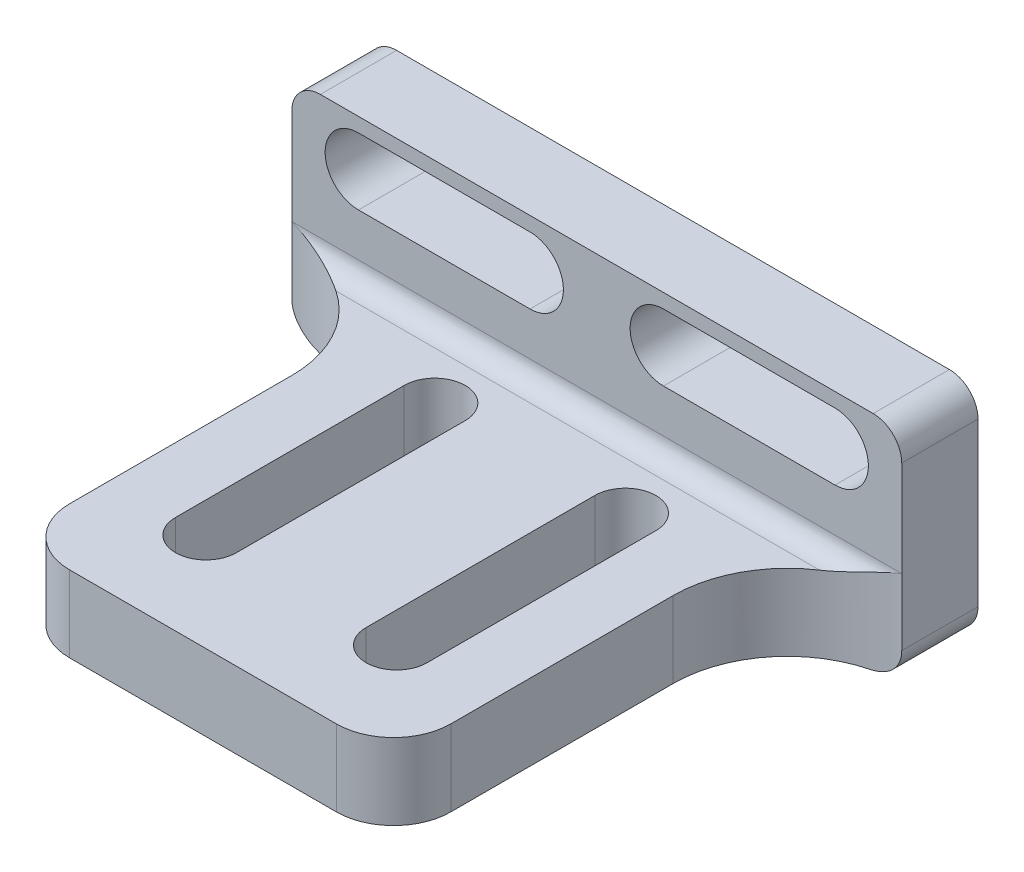
from build123d import *

# Parameters (mm, degrees)
EXTRUDE_1_DEPTH           = 3
SKETCH_7_R                = 2.25
CUT_EXTRUDE_2_DEPTH       = 143.955430949
SKETCH_8_R                = 8
CUT_EXTRUDE_3_DEPTH       = 143.955430949
CUT_EXTRUDE_4_DEPTH       = 3
CUT_EXTRUDE_5_DEPTH       = 3
CUT_EXTRUDE_8_DEPTH       = 3
SKETCH_12_R               = 1.7
CUT_EXTRUDE_9_DEPTH       = 3
SKETCH_13_R               = 1.7
CUT_EXTRUDE_11_DEPTH      = 3
CUT_EXTRUDE_12_DEPTH      = 143.955430949
FILLET_1_R                = 2
FILLET_2_R                = 2
CUT_EXTRUDE_13_DEPTH      = 143.955430949
CUT_EXTRUDE_14_DEPTH      = 143.955430949
CUT_EXTRUDE_15_DEPTH      = 143.955430949
CUT_EXTRUDE_16_DEPTH      = 143.955430949
EXTRUDE_2_DEPTH           = 4
EXTRUDE_2_2_DEPTH         = 4
EXTRUDE_4_DEPTH           = 4
EXTRUDE_5_DEPTH           = 35
SKETCH_25_W               = 6
SKETCH_25_H               = 31
CUT_EXTRUDE_17_DEPTH      = 5
FILLET_3_R                = 6
FILLET_4_R                = 6
FILLET_5_R                = 1.5
FILLET_6_R                = 1.5
CUT_EXTRUDE_18_DEPTH      = 5
CUT_EXTRUDE_19_DEPTH      = 15
CUT_EXTRUDE_19_DEPTH_BACK = 95
SKETCH_27_W               = 31
SKETCH_27_H               = 1
FILLET_8_R                = 1
FILLET_9_R                = 1
FILLET_10_R               = 3
SKETCH_28_W               = 85
SKETCH_28_H               = 10.343066278
CUT_EXTRUDE_20_DEPTH      = 5
FILLET_12_R               = 3
FILLET_13_R               = 3
SKETCH_32_W               = 45.323158308
SKETCH_32_H               = 39.541616474
CUT_EXTRUDE_22_DEPTH      = 40


# Read off the part's stored shape, not the designer's step: 切除-拉伸21
# Some blends are built 0.0001 mm under size
with BuildPart() as part:
    # 草图1 → 凸台-拉伸1 (new body)
    # profile 1 of 14: a face of its own
    with BuildSketch(Plane.XY):
        with BuildLine():
            Line((60, 106.603296002), (35.889163634, 121.664519159))
            Line((35.889163634, 121.664519159), (-35.889163634, 121.664519159))
            Line((-35.889163634, 121.664519159), (-60, 106.603296002))
            Line((-60, 106.603296002), (-60, 94.801892265))
            Line((-60, 94.801892265), (-45, 94.801892265))
            ThreePointArc((-45, 94.801892265), (-43.762563133, 94.289329132), (-43.25, 93.051892265))
            Line((-43.25, 93.051892265), (-37.75, 93.051892265))
            ThreePointArc((-37.75, 93.051892265), (-37.237436867, 94.289329132), (-36, 94.801892265))
            Line((-36, 94.801892265), (-21, 94.801892265))
            ThreePointArc((-21, 94.801892265), (-19.762563133, 94.289329132), (-19.25, 93.051892265))
            Line((-19.25, 93.051892265), (19.25, 93.051892265))
            ThreePointArc((19.25, 93.051892265), (19.762563133, 94.289329132), (21, 94.801892265))
            Line((21, 94.801892265), (36, 94.801892265))
            ThreePointArc((36, 94.801892265), (37.237436867, 94.289329132), (37.75, 93.051892265))
            Line((37.75, 93.051892265), (43.25, 93.051892265))
            ThreePointArc((43.25, 93.051892265), (43.762563133, 94.289329132), (45, 94.801892265))
            Line((45, 94.801892265), (60, 94.801892265))
            Line((60, 94.801892265), (60, 106.603296002))
        make_face()
    # profile 2 of 14: a face of its own
    with BuildSketch(Plane.XY):
        with BuildLine():
            Line((66.901694095, 102.292041372), (60, 106.603296002))
            Line((60, 106.603296002), (60, 94.801892265))
            ThreePointArc((60, 94.801892265), (61.237436867, 94.289329132), (61.75, 93.051892265))
            Line((61.75, 93.051892265), (66.901694095, 93.051892265))
            Line((66.901694095, 93.051892265), (66.901694095, 102.292041372))
        make_face()
    # profile 3 of 14: a face of its own
    with BuildSketch(Plane.XY):
        with BuildLine():
            Line((-60, 94.801892265), (-60, 106.603296002))
            Line((-60, 106.603296002), (-66.901694095, 102.292041372))
            Line((-66.901694095, 102.292041372), (-66.901694095, 93.051892265))
            Line((-66.901694095, 93.051892265), (-61.75, 93.051892265))
            ThreePointArc((-61.75, 93.051892265), (-61.237436867, 94.289329132), (-60, 94.801892265))
        make_face()
    # profile 4 of 14: a face of its own
    with BuildSketch(Plane.XY):
        with BuildLine():
            Line((66.901694095, 63.051892265), (66.901694095, 93.051892265))
            Line((66.901694095, 93.051892265), (61.75, 93.051892265))
            ThreePointArc((61.75, 93.051892265), (61.237436867, 91.814455398), (60, 91.301892265))
            Line((60, 91.301892265), (60, 64.801892265))
            ThreePointArc((60, 64.801892265), (61.237436867, 64.289329132), (61.75, 63.051892265))
            Line((61.75, 63.051892265), (66.901694095, 63.051892265))
        make_face()
    # profile 5 of 14: a face of its own
    with BuildSketch(Plane.XY):
        with BuildLine():
            Line((-61.75, 93.051892265), (-66.901694095, 93.051892265))
            Line((-66.901694095, 93.051892265), (-66.901694095, 63.051892265))
            Line((-66.901694095, 63.051892265), (-61.75, 63.051892265))
            ThreePointArc((-61.75, 63.051892265), (-61.237436867, 64.289329132), (-60, 64.801892265))
            Line((-60, 64.801892265), (-60, 91.301892265))
            ThreePointArc((-60, 91.301892265), (-61.237436867, 91.814455398), (-61.75, 93.051892265))
        make_face()
    # profile 6 of 14: a face of its own
    with BuildSketch(Plane.XY):
        with BuildLine():
            Line((66.901694095, 52.870133869), (66.901694095, 63.051892265))
            Line((66.901694095, 63.051892265), (61.75, 63.051892265))
            ThreePointArc((61.75, 63.051892265), (61.237436867, 61.814455398), (60, 61.301892265))
            Line((60, 61.301892265), (60, 31.261343001))
            Line((60, 31.261343001), (75, 31.261343001))
            Line((75, 31.261343001), (75, 40.933889795))
            ThreePointArc((75, 40.933889795), (69.117351927, 45.658052319), (66.901694095, 52.870133869))
        make_face()
    # profile 7 of 14: a face of its own
    with BuildSketch(Plane.XY):
        with BuildLine():
            Line((60, 64.801892265), (60, 91.301892265))
            Line((60, 91.301892265), (45, 91.301892265))
            ThreePointArc((45, 91.301892265), (43.762563133, 91.814455398), (43.25, 93.051892265))
            Line((43.25, 93.051892265), (37.75, 93.051892265))
            ThreePointArc((37.75, 93.051892265), (37.237436867, 91.814455398), (36, 91.301892265))
            Line((36, 91.301892265), (21, 91.301892265))
            ThreePointArc((21, 91.301892265), (19.762563133, 91.814455398), (19.25, 93.051892265))
            Line((19.25, 93.051892265), (-19.25, 93.051892265))
            ThreePointArc((-19.25, 93.051892265), (-19.762563133, 91.814455398), (-21, 91.301892265))
            Line((-21, 91.301892265), (-36, 91.301892265))
            ThreePointArc((-36, 91.301892265), (-37.237436867, 91.814455398), (-37.75, 93.051892265))
            Line((-37.75, 93.051892265), (-43.25, 93.051892265))
            ThreePointArc((-43.25, 93.051892265), (-43.762563133, 91.814455398), (-45, 91.301892265))
            Line((-45, 91.301892265), (-60, 91.301892265))
            Line((-60, 91.301892265), (-60, 64.801892265))
            Line((-60, 64.801892265), (-45, 64.801892265))
            ThreePointArc((-45, 64.801892265), (-43.762563133, 64.289329132), (-43.25, 63.051892265))
            Line((-43.25, 63.051892265), (-37.75, 63.051892265))
            ThreePointArc((-37.75, 63.051892265), (-37.237436867, 64.289329132), (-36, 64.801892265))
            Line((-36, 64.801892265), (-21, 64.801892265))
            ThreePointArc((-21, 64.801892265), (-19.762563133, 64.289329132), (-19.25, 63.051892265))
            Line((-19.25, 63.051892265), (19.25, 63.051892265))
            ThreePointArc((19.25, 63.051892265), (19.762563133, 64.289329132), (21, 64.801892265))
            Line((21, 64.801892265), (36, 64.801892265))
            ThreePointArc((36, 64.801892265), (37.237436867, 64.289329132), (37.75, 63.051892265))
            Line((37.75, 63.051892265), (43.25, 63.051892265))
            ThreePointArc((43.25, 63.051892265), (43.762563133, 64.289329132), (45, 64.801892265))
            Line((45, 64.801892265), (60, 64.801892265))
        make_face()
    # profile 8 of 14: a face of its own
    with BuildSketch(Plane.XY):
        with BuildLine():
            Line((-61.75, 63.051892265), (-66.901694095, 63.051892265))
            Line((-66.901694095, 63.051892265), (-66.901694095, 52.870133869))
            ThreePointArc((-66.901694095, 52.870133869), (-69.117351927, 45.658052319), (-75, 40.933889795))
            Line((-75, 40.933889795), (-75, 31.261343001))
            Line((-75, 31.261343001), (-60, 31.261343001))
            Line((-60, 31.261343001), (-60, 61.301892265))
            ThreePointArc((-60, 61.301892265), (-61.237436867, 61.814455398), (-61.75, 63.051892265))
        make_face()
    # profile 9 of 14: a face of its own
    with BuildSketch(Plane.XY):
        with BuildLine():
            Line((60, 31.261343001), (60, 61.301892265))
            Line((60, 61.301892265), (45, 61.301892265))
            ThreePointArc((45, 61.301892265), (43.762563133, 61.814455398), (43.25, 63.051892265))
            Line((43.25, 63.051892265), (37.75, 63.051892265))
            ThreePointArc((37.75, 63.051892265), (37.237436867, 61.814455398), (36, 61.301892265))
            Line((36, 61.301892265), (21, 61.301892265))
            ThreePointArc((21, 61.301892265), (19.762563133, 61.814455398), (19.25, 63.051892265))
            Line((19.25, 63.051892265), (-19.25, 63.051892265))
            ThreePointArc((-19.25, 63.051892265), (-19.762563133, 61.814455398), (-21, 61.301892265))
            Line((-21, 61.301892265), (-36, 61.301892265))
            ThreePointArc((-36, 61.301892265), (-37.237436867, 61.814455398), (-37.75, 63.051892265))
            Line((-37.75, 63.051892265), (-43.25, 63.051892265))
            ThreePointArc((-43.25, 63.051892265), (-43.762563133, 61.814455398), (-45, 61.301892265))
            Line((-45, 61.301892265), (-60, 61.301892265))
            Line((-60, 61.301892265), (-60, 31.261343001))
            Line((-60, 31.261343001), (60, 31.261343001))
        make_face()
    # profile 10 of 14: a face of its own
    with BuildSketch(Plane.XY):
        with BuildLine():
            Line((60, -58.312864289), (60, 23.940028391))
            Line((60, 23.940028391), (-60, 23.940028391))
            Line((-60, 23.940028391), (-60, -58.312864289))
            Line((-60, -58.312864289), (-45, -58.312864289))
            ThreePointArc((-45, -58.312864289), (-43.25, -60.062864289), (-45, -61.812864289))
            Line((-45, -61.812864289), (-60, -61.812864289))
            Line((-60, -61.812864289), (-60, -88.312864289))
            Line((-60, -88.312864289), (-45, -88.312864289))
            ThreePointArc((-45, -88.312864289), (-43.25, -90.062864289), (-45, -91.812864289))
            Line((-45, -91.812864289), (-60, -91.812864289))
            Line((-60, -91.812864289), (-60, -111.849967256))
            Line((-60, -111.849967256), (-38.845469114, -105.590576733))
            ThreePointArc((-38.845469114, -105.590576733), (-36.037784492, -104.975210108), (-33.17088573, -104.768665882))
            Line((-33.17088573, -104.768665882), (33.17088573, -104.768665882))
            ThreePointArc((33.17088573, -104.768665882), (36.037784492, -104.975210108), (38.845469114, -105.590576733))
            Line((38.845469114, -105.590576733), (60, -111.849967256))
            Line((60, -111.849967256), (60, -91.812864289))
            Line((60, -91.812864289), (45, -91.812864289))
            ThreePointArc((45, -91.812864289), (43.762563133, -91.300301156), (43.25, -90.062864289))
            ThreePointArc((43.25, -90.062864289), (43.762563133, -88.825427422), (45, -88.312864289))
            Line((45, -88.312864289), (60, -88.312864289))
            Line((60, -88.312864289), (60, -61.812864289))
            Line((60, -61.812864289), (45, -61.812864289))
            ThreePointArc((45, -61.812864289), (43.762563133, -61.300301156), (43.25, -60.062864289))
            ThreePointArc((43.25, -60.062864289), (43.762563133, -58.825427422), (45, -58.312864289))
            Line((45, -58.312864289), (60, -58.312864289))
        make_face()
        with BuildLine():
            ThreePointArc((-21, -88.312864289), (-19.762563133, -88.825427422), (-19.25, -90.062864289))
            ThreePointArc((-19.25, -90.062864289), (-19.762563133, -91.300301156), (-21, -91.812864289))
            Line((-21, -91.812864289), (-36, -91.812864289))
            ThreePointArc((-36, -91.812864289), (-37.75, -90.062864289), (-36, -88.312864289))
            Line((-36, -88.312864289), (-21, -88.312864289))
        make_face(mode=Mode.SUBTRACT)
        with BuildLine():
            ThreePointArc((-21, -58.312864289), (-19.762563133, -58.825427422), (-19.25, -60.062864289))
            ThreePointArc((-19.25, -60.062864289), (-19.762563133, -61.300301156), (-21, -61.812864289))
            Line((-21, -61.812864289), (-36, -61.812864289))
            ThreePointArc((-36, -61.812864289), (-37.75, -60.062864289), (-36, -58.312864289))
            Line((-36, -58.312864289), (-21, -58.312864289))
        make_face(mode=Mode.SUBTRACT)
        with BuildLine():
            ThreePointArc((36, -88.312864289), (37.237436867, -88.825427422), (37.75, -90.062864289))
            ThreePointArc((37.75, -90.062864289), (37.237436867, -91.300301156), (36, -91.812864289))
            Line((36, -91.812864289), (21, -91.812864289))
            ThreePointArc((21, -91.812864289), (19.762563133, -91.300301156), (19.25, -90.062864289))
            ThreePointArc((19.25, -90.062864289), (19.762563133, -88.825427422), (21, -88.312864289))
            Line((21, -88.312864289), (36, -88.312864289))
        make_face(mode=Mode.SUBTRACT)
        with BuildLine():
            ThreePointArc((36, -58.312864289), (37.237436867, -58.825427422), (37.75, -60.062864289))
            ThreePointArc((37.75, -60.062864289), (37.237436867, -61.300301156), (36, -61.812864289))
            Line((36, -61.812864289), (21, -61.812864289))
            ThreePointArc((21, -61.812864289), (19.762563133, -61.300301156), (19.25, -60.062864289))
            ThreePointArc((19.25, -60.062864289), (19.762563133, -58.825427422), (21, -58.312864289))
            Line((21, -58.312864289), (36, -58.312864289))
        make_face(mode=Mode.SUBTRACT)
    # profile 11 of 14: a face of its own
    with BuildSketch(Plane.XY):
        with BuildLine():
            Line((75, 23.940028391), (60, 23.940028391))
            Line((60, 23.940028391), (60, -58.312864289))
            ThreePointArc((60, -58.312864289), (61.237436867, -58.825427422), (61.75, -60.062864289))
            Line((61.75, -60.062864289), (67.402721334, -60.062864289))
            add(Edge.make_bspline(
                [(75, 10.562559835), (72.695878257, 1.907314233), (70.339582535, -13.372796253), (67.818206704, -36.939032951), (67.208860388, -51.77269444), (67.402721334, -60.062864289)],
                knots=[0, 0, 0, 0, 0.235246678, 0.40629419, 0.624108181, 0.624108181, 0.624108181, 0.624108181], degree=3))
            Line((75, 10.562559835), (75, 23.940028391))
        make_face()
    # profile 12 of 14: a face of its own
    with BuildSketch(Plane.XY):
        with BuildLine():
            Line((-60, -58.312864289), (-60, 23.940028391))
            Line((-60, 23.940028391), (-75, 23.940028391))
            Line((-75, 23.940028391), (-75, 10.562559835))
            add(Edge.make_bspline(
                [(-75, 10.562559835), (-72.695878257, 1.907314233), (-70.339582535, -13.372796253), (-67.818206704, -36.939032951), (-67.208860388, -51.77269444), (-67.402721334, -60.062864289)],
                knots=[0, 0, 0, 0, 0.235246678, 0.40629419, 0.624108181, 0.624108181, 0.624108181, 0.624108181], degree=3))
            add(Edge.make_bspline(
                [(-67.402721334, -60.062864289), (-67.560325872, -66.802583754), (-68.323504015, -76.843670093), (-70.154131955, -86.778530076), (-70.533712858, -90.062864289)],
                knots=[0.624108181, 0.624108181, 0.624108181, 0.624108181, 0.801186001, 0.888408652, 0.888408652, 0.888408652, 0.888408652], degree=3))
            add(Edge.make_bspline(
                [(-70.533712858, -90.062864289), (-71.019342956, -94.264792095), (-71.137422935, -98.476048206), (-70.1742624, -102.732794059)],
                knots=[0.888408652, 0.888408652, 0.888408652, 0.888408652, 1, 1, 1, 1], degree=3))
            Line((-70.1742624, -102.732794059), (-66.460817635, -113.761651372))
            Line((-66.460817635, -113.761651372), (-60, -111.849967256))
            Line((-60, -111.849967256), (-60, -91.812864289))
            ThreePointArc((-60, -91.812864289), (-61.75, -90.062864289), (-60, -88.312864289))
            Line((-60, -88.312864289), (-60, -61.812864289))
            ThreePointArc((-60, -61.812864289), (-61.75, -60.062864289), (-60, -58.312864289))
        make_face()
    # profile 13 of 14: a face of its own
    with BuildSketch(Plane.XY):
        with BuildLine():
            Line((67.402721334, -60.062864289), (61.75, -60.062864289))
            ThreePointArc((61.75, -60.062864289), (61.237436867, -61.300301156), (60, -61.812864289))
            Line((60, -61.812864289), (60, -88.312864289))
            ThreePointArc((60, -88.312864289), (61.237436867, -88.825427422), (61.75, -90.062864289))
            Line((61.75, -90.062864289), (70.533712858, -90.062864289))
            add(Edge.make_bspline(
                [(67.402721334, -60.062864289), (67.560325872, -66.802583754), (68.323504015, -76.843670093), (70.154131955, -86.778530076), (70.533712858, -90.062864289)],
                knots=[0.624108181, 0.624108181, 0.624108181, 0.624108181, 0.801186001, 0.888408652, 0.888408652, 0.888408652, 0.888408652], degree=3))
        make_face()
    # profile 14 of 14: a face of its own
    with BuildSketch(Plane.XY):
        with BuildLine():
            add(Edge.make_bspline(
                [(70.533712858, -90.062864289), (71.019342956, -94.264792095), (71.137422935, -98.476048206), (70.1742624, -102.732794059)],
                knots=[0.888408652, 0.888408652, 0.888408652, 0.888408652, 1, 1, 1, 1], degree=3))
            Line((70.533712858, -90.062864289), (61.75, -90.062864289))
            ThreePointArc((61.75, -90.062864289), (61.237436867, -91.300301156), (60, -91.812864289))
            Line((60, -91.812864289), (60, -111.849967256))
            Line((60, -111.849967256), (66.460817635, -113.761651372))
            Line((66.460817635, -113.761651372), (70.1742624, -102.732794059))
        make_face()
    extrude(amount=EXTRUDE_1_DEPTH)

    # 草图7 → 切除-拉伸2 (cut, through all)
    with BuildSketch(Plane(origin=(0, 0, 0), x_dir=(-1, 0, 0), z_dir=(0, 0, -1))):
        with Locations((-21, 41.261343001)):
            Circle(SKETCH_7_R)
        with Locations((21, 41.261343001)):
            Circle(SKETCH_7_R)
        with Locations((-21, 13.940028391)):
            Circle(SKETCH_7_R)
        with Locations((21, 13.940028391)):
            Circle(SKETCH_7_R)
    extrude(amount=-CUT_EXTRUDE_2_DEPTH, mode=Mode.SUBTRACT)

    # 草图8 → 切除-拉伸3 (cut, through all)
    with BuildSketch(Plane.XY.offset(3)):
        with BuildLine():
            Line((-12.621438714, -0.378557945), (-33.409010345, 20.409013685))
            ThreePointArc((-33.409010345, 20.409013685), (-36.590999434, 20.409013643), (-36.590999309, 17.227024553))
            Line((-36.590999309, 17.227024553), (-15.803426586, -3.560545984))
            ThreePointArc((-15.803426586, -3.560545984), (-12.621438673, -3.560545859), (-12.621438714, -0.378557945))
        make_face()
        with BuildLine():
            Line((33.410462056, 20.410458798), (12.572988319, -0.427010824))
            ThreePointArc((12.572988319, -0.427010824), (12.644570441, -3.584764993), (15.803045702, -3.56090242))
            Line((15.803045702, -3.56090242), (34.999999982, 15.636052774))
            Line((34.999999982, 15.636052774), (36.588086952, 17.224139819))
            ThreePointArc((36.588086952, 17.224139819), (36.592433993, 20.406111757), (33.410462056, 20.410458798))
        make_face()
        with BuildLine():
            Line((-15.803784812, -28.80377835), (-36.591002186, -49.590991619))
            ThreePointArc((-36.591002186, -49.590991619), (-36.591002403, -52.772972232), (-33.40902179, -52.772972254))
            Line((-33.40902179, -52.772972254), (-12.573723916, -31.937673388))
            ThreePointArc((-12.573723916, -31.937673388), (-12.64530628, -28.779915954), (-15.803784812, -28.80377835))
        make_face()
        with BuildLine():
            Line((36.590992666, -49.590989326), (15.803414627, -28.803411286))
            ThreePointArc((15.803414627, -28.803411286), (12.654338964, -28.769774302), (12.55344336, -31.917412949))
            Line((12.55344336, -31.917412949), (33.409007381, -52.772974779))
            ThreePointArc((33.409007381, -52.772974779), (36.590992708, -52.772974653), (36.590992666, -49.590989326))
        make_face()
        with Locations((-0.000368782, -16.182341354)):
            Circle(SKETCH_8_R)
    extrude(amount=-CUT_EXTRUDE_3_DEPTH, mode=Mode.SUBTRACT)

    # 草图9 → 切除-拉伸4 (cut)
    with BuildSketch(Plane.XY.offset(3)):
        with BuildLine():
            Line((55, -100.49704609), (20, -100.49704609))
            ThreePointArc((20, -100.49704609), (18.25, -98.74704609), (20, -96.99704609))
            Line((20, -96.99704609), (55, -96.99704609))
            ThreePointArc((55, -96.99704609), (56.75, -98.74704609), (55, -100.49704609))
        make_face()
        with BuildLine():
            Line((-55, -96.99704609), (-20, -96.99704609))
            ThreePointArc((-20, -96.99704609), (-18.25, -98.74704609), (-20, -100.49704609))
            Line((-20, -100.49704609), (-55, -100.49704609))
            ThreePointArc((-55, -100.49704609), (-56.75, -98.74704609), (-55, -96.99704609))
        make_face()
    extrude(amount=-CUT_EXTRUDE_4_DEPTH, mode=Mode.SUBTRACT)

    # 草图10 → 切除-拉伸5 (cut)
    with BuildSketch(Plane.XY.offset(3)):
        with BuildLine():
            Line((12.5, -80.062864289), (-12.5, -80.062864289))
            ThreePointArc((-12.5, -80.062864289), (-17.5, -75.062864289), (-12.5, -70.062864289))
            Line((-12.5, -70.062864289), (12.5, -70.062864289))
            ThreePointArc((12.5, -70.062864289), (17.5, -75.062864289), (12.5, -80.062864289))
        make_face()
    extrude(amount=-CUT_EXTRUDE_5_DEPTH, mode=Mode.SUBTRACT)

    # 草图11 → 切除-拉伸8 (cut)
    with BuildSketch(Plane.XY.offset(3)):
        with BuildLine():
            Line((15, 73.051892265), (-15, 73.051892265))
            ThreePointArc((-15, 73.051892265), (-20, 78.051892265), (-15, 83.051892265))
            Line((-15, 83.051892265), (15, 83.051892265))
            ThreePointArc((15, 83.051892265), (20, 78.051892265), (15, 73.051892265))
        make_face()
    extrude(amount=-CUT_EXTRUDE_8_DEPTH, mode=Mode.SUBTRACT)

    # 草图12 → 切除-拉伸9 (cut)
    with BuildSketch(Plane.XY.offset(3)):
        with Locations((0, 114.371786435)):
            Circle(SKETCH_12_R)
        with Locations((0, 98.371786435)):
            Circle(SKETCH_12_R)
        with Locations((8, 106.371786435)):
            Circle(SKETCH_12_R)
        with Locations((-8, 106.371786435)):
            Circle(SKETCH_12_R)
    extrude(amount=-CUT_EXTRUDE_9_DEPTH, mode=Mode.SUBTRACT)

    # 草图13 → 切除-拉伸11 (cut)
    with BuildSketch(Plane.XY.offset(3)):
        with Locations((0, -84.415765086)):
            Circle(SKETCH_13_R)
        with Locations((8, -92.415765086)):
            Circle(SKETCH_13_R)
        with Locations((0, -100.415765086)):
            Circle(SKETCH_13_R)
        with Locations((-8, -92.415765086)):
            Circle(SKETCH_13_R)
    extrude(amount=-CUT_EXTRUDE_11_DEPTH, mode=Mode.SUBTRACT)

    # 草图14 → 切除-拉伸12 (cut, through all)
    with BuildSketch(Plane.XY.offset(3)):
        with BuildLine():
            Line((-55.475501567, 8.919687236), (-55.475501567, -46.080312764))
            ThreePointArc((-55.475501567, -46.080312764), (-57.225501567, -47.830312764), (-58.975501567, -46.080312764))
            Line((-58.975501567, -46.080312764), (-58.975501567, 8.919687236))
            ThreePointArc((-58.975501567, 8.919687236), (-57.225501567, 10.669687236), (-55.475501567, 8.919687236))
        make_face()
        with BuildLine():
            Line((58.975501567, 8.919687236), (58.975501567, -46.080312764))
            ThreePointArc((58.975501567, -46.080312764), (57.225501567, -47.830312764), (55.475501567, -46.080312764))
            Line((55.475501567, -46.080312764), (55.475501567, 8.919687236))
            ThreePointArc((55.475501567, 8.919687236), (57.225501567, 10.669687236), (58.975501567, 8.919687236))
        make_face()
    extrude(amount=-CUT_EXTRUDE_12_DEPTH, mode=Mode.SUBTRACT)

    # 圆角1
    fillet_1_edges = [part.edges().sort_by_distance(p)[0] for p in [
        (75, 31.261343001, 1.5),
        (-75, 31.261343001, 1.5),
    ]]
    fillet(fillet_1_edges, radius=FILLET_1_R)

    # 圆角2
    fillet_2_edges = [part.edges().sort_by_distance(p)[0] for p in [
        (-75, 23.940028391, 1.5),
        (75, 23.940028391, 1.5),
    ]]
    fillet(fillet_2_edges, radius=FILLET_2_R)

    # 草图15 → 切除-拉伸13 (cut, through all)
    with BuildSketch(Plane(origin=(0, 0, 0), x_dir=(-1, 0, 0), z_dir=(0, 0, -1))):
        with BuildLine():
            Line((-61.184216401, 102.403501276), (-34.774762862, 118.900592756))
            ThreePointArc((-34.774762862, 118.900592756), (-32.70788159, 118.423097411), (-33.185376934, 116.356216138))
            Line((-33.185376934, 116.356216138), (-59.594830473, 99.859124658))
            ThreePointArc((-59.594830473, 99.859124658), (-61.661711746, 100.336620003), (-61.184216401, 102.403501276))
        make_face()
        with BuildLine():
            Line((59.594830473, 99.859124658), (33.185376934, 116.356216138))
            ThreePointArc((33.185376934, 116.356216138), (32.70788159, 118.423097411), (34.774762862, 118.900592756))
            Line((34.774762862, 118.900592756), (61.184216401, 102.403501276))
            ThreePointArc((61.184216401, 102.403501276), (61.661711746, 100.336620003), (59.594830473, 99.859124658))
        make_face()
    extrude(amount=-CUT_EXTRUDE_13_DEPTH, mode=Mode.SUBTRACT)

    # 草图16 → 切除-拉伸14 (cut, through all)
    with BuildSketch(Plane(origin=(0, 0, 0), x_dir=(-1, 0, 0), z_dir=(0, 0, -1))):
        with BuildLine():
            Line((-61.516979467, 42.761343001), (-32.056291893, 42.761343001))
            ThreePointArc((-32.056291893, 42.761343001), (-30.556291893, 41.261343001), (-32.056291893, 39.761343001))
            Line((-32.056291893, 39.761343001), (-61.516979467, 39.761343001))
            ThreePointArc((-61.516979467, 39.761343001), (-63.016979467, 41.261343001), (-61.516979467, 42.761343001))
        make_face()
        with BuildLine():
            Line((61.516979467, 39.761343001), (32.056291893, 39.761343001))
            ThreePointArc((32.056291893, 39.761343001), (30.556291893, 41.261343001), (32.056291893, 42.761343001))
            Line((32.056291893, 42.761343001), (61.516979467, 42.761343001))
            ThreePointArc((61.516979467, 42.761343001), (63.016979467, 41.261343001), (61.516979467, 39.761343001))
        make_face()
    extrude(amount=-CUT_EXTRUDE_14_DEPTH, mode=Mode.SUBTRACT)

    # 草图17 → 切除-拉伸15 (cut, through all)
    with BuildSketch(Plane(origin=(0, 0, 0), x_dir=(-1, 0, 0), z_dir=(0, 0, -1))):
        Polygon((-28.645414283, -8.118433382), (-34.644957411, -20.11751964), (-34.644957411, -29.946558382), (-37.580904049, -29.946558382), (-37.580904049, -20.11751964), (-43.580447177, -8.118433382), (-40.64450054, -8.118433382), (-36.176755657, -17.43687271), (-36.049105803, -17.43687271), (-31.58136092, -8.118433382), align=None)
    extrude(amount=-CUT_EXTRUDE_15_DEPTH, mode=Mode.SUBTRACT)

    # 草图18 → 切除-拉伸16 (cut, through all)
    with BuildSketch(Plane(origin=(0, 0, 0), x_dir=(-1, 0, 0), z_dir=(0, 0, -1))):
        Polygon((46.06697123, -29.087529791), (43.131024593, -29.087529791), (43.131024593, -18.875541487), (35.854982926, -18.875541487), (35.854982926, -29.087529791), (32.919036289, -29.087529791), (32.919036289, -7.259404791), (35.854982926, -7.259404791), (35.854982926, -16.450194265), (43.131024593, -16.450194265), (43.131024593, -7.259404791), (46.06697123, -7.259404791), align=None)
    extrude(amount=-CUT_EXTRUDE_16_DEPTH, mode=Mode.SUBTRACT)


with BuildPart() as body_2:
    # 草图19 → 凸台-拉伸2 (new body)
    with BuildSketch(Plane.XY.offset(13)):
        Polygon((16.5, -101.24704609), (16.5, -96.24704609), (48.5, -96.24704609), (48.5, -101.24704609), (48.5, -104.768665882), (16.5, -104.768665882), align=None)
        with BuildLine():
            Line((20, -100.49704609), (45, -100.49704609))
            ThreePointArc((45, -100.49704609), (46.75, -98.74704609), (45, -96.99704609))
            Line((45, -96.99704609), (20, -96.99704609))
            ThreePointArc((20, -96.99704609), (18.25, -98.74704609), (20, -100.49704609))
        make_face(mode=Mode.SUBTRACT)
    extrude(amount=EXTRUDE_2_DEPTH)



with BuildPart() as body_3:
    # 草图19 → Extrude 2 2 (new body)
    with BuildSketch(Plane.XY.offset(13)):
        Polygon((-16.5, -101.24704609), (-16.5, -104.768665882), (-48.5, -104.768665882), (-48.5, -101.24704609), (-48.5, -96.24704609), (-16.5, -96.24704609), align=None)
        with BuildLine():
            Line((-45, -96.99704609), (-20, -96.99704609))
            ThreePointArc((-20, -96.99704609), (-18.25, -98.74704609), (-20, -100.49704609))
            Line((-20, -100.49704609), (-45, -100.49704609))
            ThreePointArc((-45, -100.49704609), (-46.75, -98.74704609), (-45, -96.99704609))
        make_face(mode=Mode.SUBTRACT)
    extrude(amount=EXTRUDE_2_2_DEPTH)


with BuildPart() as body_2_1:
    add(body_2.part)

    add(body_3.part)  # 凸台-拉伸4 merges body 3
    # 草图21 → 凸台-拉伸4 (add)
    with BuildSketch(Plane.XY.offset(17)):
        with BuildLine():
            Line((-36, -96.99704609), (-29, -96.99704609))
            ThreePointArc((-29, -96.99704609), (-30.75, -98.74704609), (-29, -100.49704609))
            Line((-29, -100.49704609), (-36, -100.49704609))
            ThreePointArc((-36, -100.49704609), (-34.25, -98.74704609), (-36, -96.99704609))
        make_face()
        with BuildLine():
            Line((36, -100.49704609), (29, -100.49704609))
            ThreePointArc((29, -100.49704609), (30.75, -98.74704609), (29, -96.99704609))
            Line((29, -96.99704609), (36, -96.99704609))
            ThreePointArc((36, -96.99704609), (34.25, -98.74704609), (36, -100.49704609))
        make_face()
    extrude(amount=-EXTRUDE_4_DEPTH)

    # 草图23 → 凸台-拉伸5 (add)
    with BuildSketch(Plane.XY.offset(13)):
        Polygon((-48.5, -104.768665882), (-48.5, -107.768665882), (-16.5, -107.768665882), (-16.5, -104.768665882), (-16.5, -102.768665882), (-48.5, -102.768665882), align=None)
        Polygon((16.5, -104.768665882), (16.5, -107.768665882), (48.5, -107.768665882), (48.5, -104.768665882), (48.5, -102.768665882), (16.5, -102.768665882), align=None)
    extrude(amount=EXTRUDE_5_DEPTH)

    # 草图25 → 切除-拉伸17 (cut)
    with BuildSketch(Plane(origin=(0, -102.768665882, 0), x_dir=(1, 0, 0), z_dir=(0, 1, 0))):
        with Locations((-19.5, -32.5)):
            Rectangle(SKETCH_25_W, SKETCH_25_H)
        with Locations((-45.5, -32.5)):
            Rectangle(SKETCH_25_W, SKETCH_25_H)
        with Locations((19.5, -32.5)):
            Rectangle(SKETCH_25_W, SKETCH_25_H)
        with Locations((45.5, -32.5)):
            Rectangle(SKETCH_25_W, SKETCH_25_H)
    extrude(amount=-CUT_EXTRUDE_17_DEPTH, mode=Mode.SUBTRACT)

    # 圆角3
    fillet_3_edges = [body_2_1.edges().sort_by_distance(p)[0] for p in [
        (22.5, -105.268665882, 17),
        (42.5, -105.268665882, 17),
    ]]
    fillet(fillet_3_edges, radius=FILLET_3_R - 0.0001)  # a hair under: the kernel refuses the full size

    # 圆角4
    fillet_4_edges = [body_2_1.edges().sort_by_distance(p)[0] for p in [
        (-42.5, -105.268665882, 17),
        (-22.5, -105.268665882, 17),
    ]]
    fillet(fillet_4_edges, radius=FILLET_4_R - 0.0001)  # a hair under: the kernel refuses the full size

    # 圆角5
    fillet_5_edges = [body_2_1.edges().sort_by_distance(p)[0] for p in [
        (16.5, -96.24704609, 15),
        (48.5, -96.24704609, 15),
        (48.5, -107.768665882, 15),
        (16.5, -107.768665882, 15),
    ]]
    fillet(fillet_5_edges, radius=FILLET_5_R)

    # 圆角6
    fillet_6_edges = [body_2_1.edges().sort_by_distance(p)[0] for p in [
        (-48.5, -96.24704609, 15),
        (-16.5, -96.24704609, 15),
        (-16.5, -107.768665882, 15),
        (-48.5, -107.768665882, 15),
    ]]
    fillet(fillet_6_edges, radius=FILLET_6_R)

    # 草图26 → 切除-拉伸18 (cut)
    with BuildSketch(Plane.XZ.offset(107.768665882)):
        with BuildLine():
            Line((35.9, 20.5), (35.9, 32.5))
            ThreePointArc((35.9, 32.5), (37.5, 34.1), (39.1, 32.5))
            Line((39.1, 32.5), (39.1, 20.5))
            ThreePointArc((39.1, 20.5), (37.5, 18.9), (35.9, 20.5))
        make_face()
        with BuildLine():
            Line((25.9, 20.5), (25.9, 32.5))
            ThreePointArc((25.9, 32.5), (27.5, 34.1), (29.1, 32.5))
            Line((29.1, 32.5), (29.1, 20.5))
            ThreePointArc((29.1, 20.5), (27.5, 18.9), (25.9, 20.5))
        make_face()
        with BuildLine():
            Line((-29.1, 20.5), (-29.1, 32.5))
            ThreePointArc((-29.1, 32.5), (-27.5, 34.1), (-25.9, 32.5))
            Line((-25.9, 32.5), (-25.9, 20.5))
            ThreePointArc((-25.9, 20.5), (-27.5, 18.9), (-29.1, 20.5))
        make_face()
        with BuildLine():
            Line((-39.1, 20.5), (-39.1, 32.5))
            ThreePointArc((-39.1, 32.5), (-37.5, 34.1), (-35.9, 32.5))
            Line((-35.9, 32.5), (-35.9, 20.5))
            ThreePointArc((-35.9, 20.5), (-37.5, 18.9), (-39.1, 20.5))
        make_face()
    extrude(amount=-CUT_EXTRUDE_18_DEPTH, mode=Mode.SUBTRACT)

    # 草图27 → 切除-拉伸19 (cut, two sides: drawn at the far end of the back side and taken through both)
    with BuildSketch(Plane(origin=(42.5, 0, 0), x_dir=(0, 0, -1), z_dir=(1, 0, 0)).offset(-CUT_EXTRUDE_19_DEPTH_BACK)):
        with Locations((-32.5, -103.268665882)):
            Rectangle(SKETCH_27_W, SKETCH_27_H)
    extrude(amount=CUT_EXTRUDE_19_DEPTH + CUT_EXTRUDE_19_DEPTH_BACK, mode=Mode.SUBTRACT)

    # 圆角8
    # the kernel refuses this fillet: 1 mm, written as the material it adds along each edge
    with BuildSketch(Plane(origin=(-12.2501, -103.768665882, 17), x_dir=(0, 0, 1), z_dir=(-1, 0, 0))) as fillet_8_piece_1_section:
        with BuildLine():
            CenterArc((FILLET_8_R, FILLET_8_R), FILLET_8_R, 180, 90)
            Line((0, FILLET_8_R), (0, 0))
            Line((0, 0), (FILLET_8_R, 0))
        make_face()
    fillet_8_piece_1 = extrude(amount=40.4998, mode=Mode.PRIVATE)
    fillet_8_piece_1 = split(fillet_8_piece_1, bisect_by=Plane(origin=(-16.5, -103.768665882, 17), z_dir=(-1, 0, 0)), keep=Keep.TOP, mode=Mode.PRIVATE)
    fillet_8_piece_1 = split(fillet_8_piece_1, bisect_by=Plane(origin=(-48.5, -103.768665882, 17), z_dir=(1, 0, 0)), keep=Keep.TOP, mode=Mode.PRIVATE)
    fillet_8_piece_1 = fillet_8_piece_1 - Plane(origin=(-48.4999, -103.768665882, 22.9999), x_dir=(1, 0, 0), z_dir=(0, -1, 0)) * Cylinder(5.9999, 85, mode=Mode.PRIVATE)
    fillet_8_piece_1 = fillet_8_piece_1 - Plane(origin=(-16.5001, -103.768665882, 22.9999), x_dir=(-1, 0, 0), z_dir=(0, -1, 0)) * Cylinder(5.9999, 85, mode=Mode.PRIVATE)
    add(fillet_8_piece_1)

    # 圆角9
    fillet_9_edges = [body_2_1.edges().sort_by_distance(p)[0] for p in [
        (32.5, -103.768665882, 17),
    ]]
    fillet(fillet_9_edges, radius=FILLET_9_R)

    # 圆角10
    fillet_10_edges = [body_2_1.edges().sort_by_distance(p)[0] for p in [
        (-42.5, -105.768665882, 48),
        (-22.5, -105.768665882, 48),
    ]]
    fillet(fillet_10_edges, radius=FILLET_10_R)

    # 草图28 → 切除-拉伸20 (cut)
    with BuildSketch(Plane.XZ.offset(107.768665882)):
        with Locations((0, 42.828466861)):
            Rectangle(SKETCH_28_W, SKETCH_28_H)
    extrude(amount=-CUT_EXTRUDE_20_DEPTH, mode=Mode.SUBTRACT)

    # 圆角12
    fillet_12_edges = [body_2_1.edges().sort_by_distance(p)[0] for p in [
        (22.5, -105.768665882, 37.656933722),
        (42.5, -105.768665882, 37.656933722),
    ]]
    fillet(fillet_12_edges, radius=FILLET_12_R)

    # 圆角13
    fillet_13_edges = [body_2_1.edges().sort_by_distance(p)[0] for p in [
        (-22.5, -105.768665882, 37.656933722),
        (-42.5, -105.768665882, 37.656933722),
    ]]
    fillet(fillet_13_edges, radius=FILLET_13_R)

    # 草图32 → 切除-拉伸22 (cut)
    with BuildSketch(Plane.XZ.offset(107.768665882)):
        with Locations((33.03738191, 27.290061412)):
            Rectangle(SKETCH_32_W, SKETCH_32_H)
    extrude(amount=-CUT_EXTRUDE_22_DEPTH, mode=Mode.SUBTRACT)


solid = body_2_1.part
